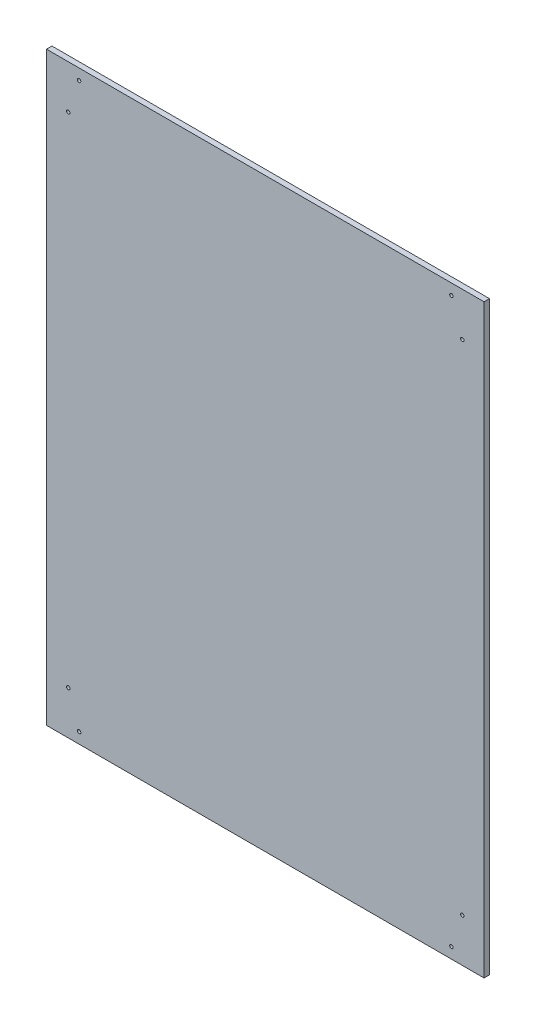
from build123d import *

# Parameters (mm, degrees)
SKETCH1_W              = 510.54
SKETCH1_H              = 683.26
BOSS_EXTRUDE1_DEPTH    = 6.35
F_10_32_TAPPED_HOLE2_D = 4.0386


with BuildPart() as part:
    # Sketch1 → Boss-Extrude1 (new body)
    with BuildSketch(Plane.XY):
        with Locations((255.27, 341.63)):
            Rectangle(SKETCH1_W, SKETCH1_H)
    extrude(amount=BOSS_EXTRUDE1_DEPTH)

    # #10-32 Tapped Hole2 (through all)
    with Locations(Plane(origin=(0, 0, 0), x_dir=(-1, 0, 0), z_dir=(0, 0, -1))):
        with Locations((-472.44, 670.56), (-485.14, 632.46), (-25.4, 632.46), (-38.1, 670.56), (-25.4, 50.8), (-38.1, 12.7), (-485.14, 50.8), (-472.44, 12.7)):
            Hole(F_10_32_TAPPED_HOLE2_D / 2)


solid = part.part
